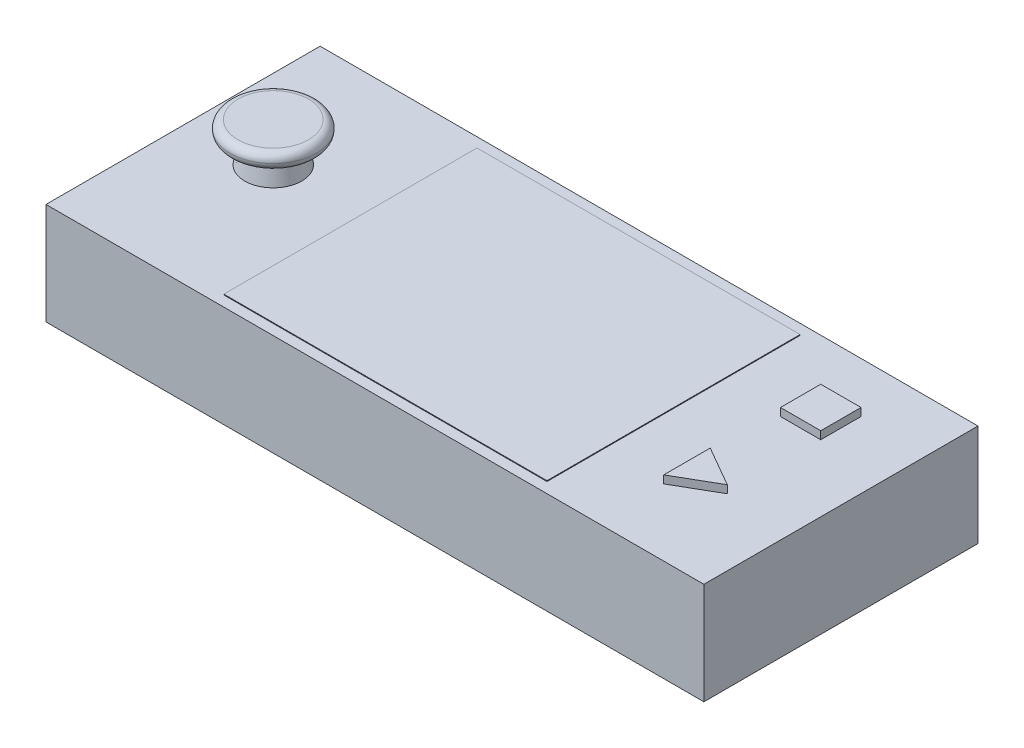
from build123d import *

# Parameters (mm, degrees)
SKETCH_1_W          = 84
SKETCH_1_H          = 35
EXTRUDE_1_DEPTH     = 13
SKETCH_2_R          = 3.636879205
EXTRUDE_2_DEPTH     = 3
EXTRUDE_2_TAPER     = 10
SKETCH_2_3_W        = 5.141866658
SKETCH_2_3_H        = 5.141866659
EXTRUDE_3_DEPTH     = 1
SKETCH_2_4_W        = 41.257358664
SKETCH_2_4_H        = 32.32030471
EXTRUDE_4_DEPTH     = 0.1
SKETCH_4_R          = 5.5
EXTRUDE_5_DEPTH     = 2
FILLET_1_R          = 1
SKETCH_5_R          = 2
SKETCH_5_W          = 9
SKETCH_5_H          = 20
CUT_EXTRUDE_1_DEPTH = 6


with BuildPart() as part:
    # 草图1 → 凸台-拉伸1 (new body)
    with BuildSketch(Plane(origin=(0, 0, 0), x_dir=(1, 0, 0), z_dir=(0, 1, 0))):
        Rectangle(SKETCH_1_W, SKETCH_1_H)
    extrude(amount=EXTRUDE_1_DEPTH)

    # 草图2 → 凸台-拉伸2 (add)
    with BuildSketch(Plane(origin=(0, 13, 0), x_dir=(1, 0, 0), z_dir=(0, 1, 0))):
        with Locations((-31.891815821, 1.407892061)):
            Circle(SKETCH_2_R)
    extrude(amount=EXTRUDE_2_DEPTH, taper=EXTRUDE_2_TAPER)

    # 草图2<3> → 凸台-拉伸3 (add)
    with BuildSketch(Plane(origin=(0, 13, 0), x_dir=(1, 0, 0), z_dir=(0, 1, 0))):
        with Locations((30.912412648, 8.508565066)):
            Rectangle(SKETCH_2_3_W, SKETCH_2_3_H)
        Polygon((28.341479319, -3.030186335), (28.341479319, -8.967502534), (33.483345977, -5.998844435), align=None)
    extrude(amount=EXTRUDE_3_DEPTH)

    # 草图2<4> → 凸台-拉伸4 (add)
    with BuildSketch(Plane(origin=(0, 13, 0), x_dir=(1, 0, 0), z_dir=(0, 1, 0))):
        Rectangle(SKETCH_2_4_W, SKETCH_2_4_H)
    extrude(amount=EXTRUDE_4_DEPTH)

    # 草图4 → 凸台-拉伸5 (add)
    with BuildSketch(Plane(origin=(0, 16, 0), x_dir=(1, 0, 0), z_dir=(0, 1, 0))):
        with Locations(Location((-31.891815821, 1.407892061, 0), (0, 0, 270))):
            Circle(SKETCH_4_R)
    extrude(amount=EXTRUDE_5_DEPTH)

    # 圆角1
    fillet_1_edges = [part.edges().sort_by_distance(p)[0] for p in [
        (-31.891815821, 16, -6.907892061),
        (-31.891815821, 18, -6.907892061),
    ]]
    fillet(fillet_1_edges, radius=FILLET_1_R - 0.0001)  # a hair under: the kernel refuses the full size

    # 草图5 → 切除-拉伸1 (cut)
    with BuildSketch(Plane.XZ):
        with Locations(Location((-38, 8, 0), (0, 0, 270))):
            Circle(SKETCH_5_R)
        with Locations(Location((-38, -8, 0), (0, 0, 270))):
            Circle(SKETCH_5_R)
        with Locations(Location((10, 8, 0), (0, 0, 270))):
            Circle(SKETCH_5_R)
        with Locations(Location((10, -8, 0), (0, 0, 270))):
            Circle(SKETCH_5_R)
        with Locations((21, 0)):
            Rectangle(SKETCH_5_W, SKETCH_5_H)
    extrude(amount=-CUT_EXTRUDE_1_DEPTH, mode=Mode.SUBTRACT)


solid = part.part
